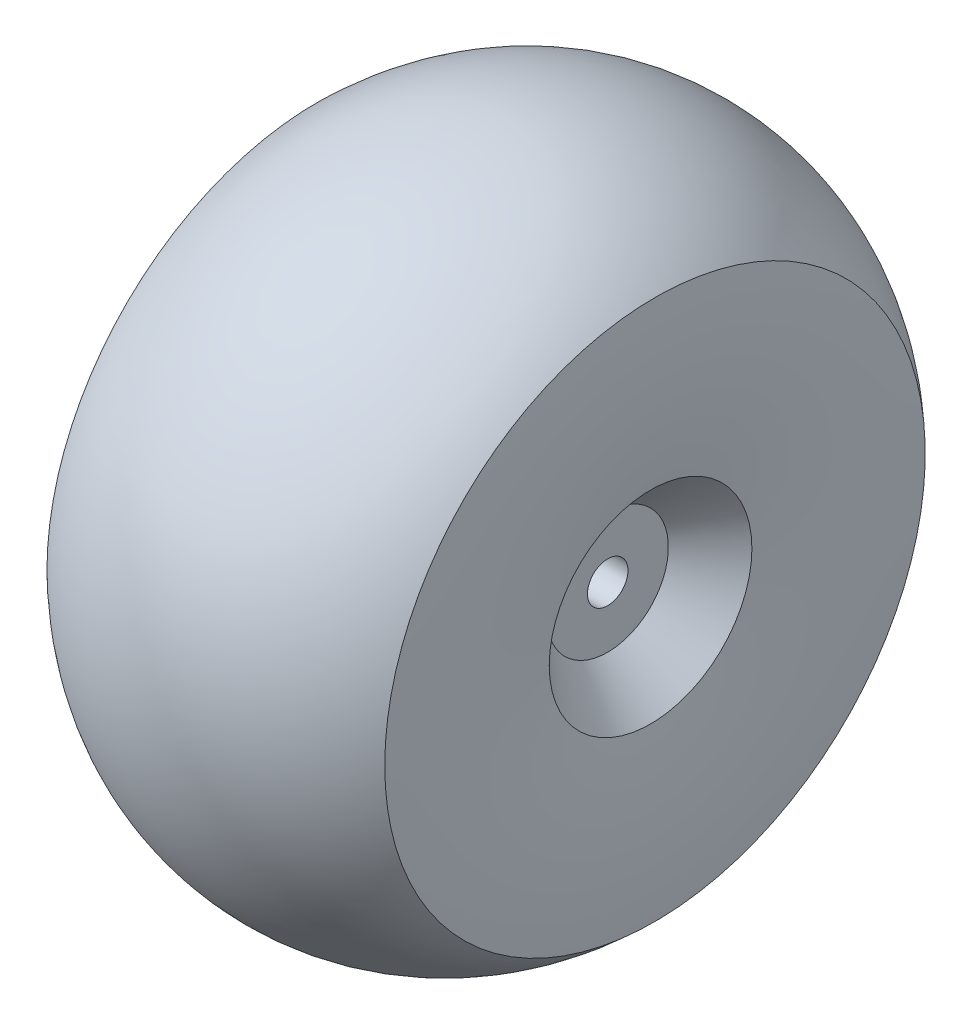
from build123d import *


with BuildPart() as part:
    # Sketch1 → Revolve1 (revolve)
    with BuildSketch(Plane.XY):
        with BuildLine():
            Line((12.17267598, 7.5), (9, 4.489242913))
            Line((9, 4.489242913), (9, 1.5))
            Line((9, 1.5), (-9, 1.5))
            Line((-9, 1.5), (-9, 4.489242913))
            Line((-9, 4.489242913), (-12.17267598, 7.5))
            ThreePointArc((-12.17267598, 7.5), (-12.636235188, 13.742146916), (-12.5, 20))
            ThreePointArc((-12.5, 20), (0, 25), (12.5, 20))
            ThreePointArc((12.5, 20), (12.636235188, 13.742146916), (12.17267598, 7.5))
        make_face()
    revolve1 = revolve(axis=Axis((0, 0, 0), (1, 0, 0)))

    # Mirror1: Revolve1 across plane
    add(revolve1.mirror(Plane(origin=(0, 0, 0), x_dir=(0, 0, 1), z_dir=(1, 0, 0))))


solid = part.part
